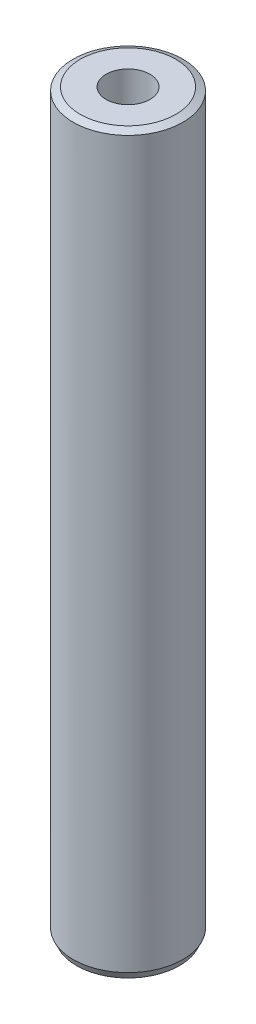
from build123d import *
from OCP.BRepFilletAPI import BRepFilletAPI_MakeChamfer

# Parameters (mm, degrees)
SKETCH1_R           = 22.5
BOSS_EXTRUDE1_DEPTH = 301.90229061
SKETCH2_R           = 9.004011125
CUT_EXTRUDE1_DEPTH  = 304.574526394
CHAMFER1_SIZE       = 1.381054608
CHAMFER1_SIZE2      = 2.884649368


with BuildPart() as part:
    # Sketch1 → Boss-Extrude1 (new body)
    with BuildSketch(Plane(origin=(0, 0, 0), x_dir=(1, 0, 0), z_dir=(0, 1, 0))):
        Circle(SKETCH1_R)
    extrude(amount=BOSS_EXTRUDE1_DEPTH)

    # Sketch2 → Cut-Extrude1 (cut, through all)
    with BuildSketch(Plane(origin=(0, 0, 0), x_dir=(1, 0, 0), z_dir=(0, 1, 0))):
        Circle(SKETCH2_R)
    extrude(amount=CUT_EXTRUDE1_DEPTH, mode=Mode.SUBTRACT)

    # Chamfer1: one chamfer whose edges measure the first distance from different faces: ONE call of the kernel's chamfer builder (chamfer() names one face for all edges)
    chamfer1_edges_1 = [part.edges().sort_by_distance(p)[0] for p in [
        (-22.5, 301.90229061, 0),
    ]]
    chamfer1_side_1 = [part.faces().sort_by_distance(p)[0] for p in [
        (-22.5, 150.951145305, 0),
    ]]
    chamfer1_edges_2 = [part.edges().sort_by_distance(p)[0] for p in [
        (-22.5, 0, 0),
    ]]
    chamfer1_side_2 = [part.faces().sort_by_distance(p)[0] for p in [
        (-21.863603897, 0, 0),
    ]]
    chamfer1 = BRepFilletAPI_MakeChamfer(part.part.solid().wrapped)
    for e in chamfer1_edges_1:
        chamfer1.Add(CHAMFER1_SIZE, CHAMFER1_SIZE2, e.wrapped, chamfer1_side_1[0].wrapped)  # the first distance lies on this face
    for e in chamfer1_edges_2:
        chamfer1.Add(CHAMFER1_SIZE, CHAMFER1_SIZE2, e.wrapped, chamfer1_side_2[0].wrapped)  # the first distance lies on this face
    add(Compound.cast(chamfer1.Shape()), mode=Mode.REPLACE)


solid = part.part
